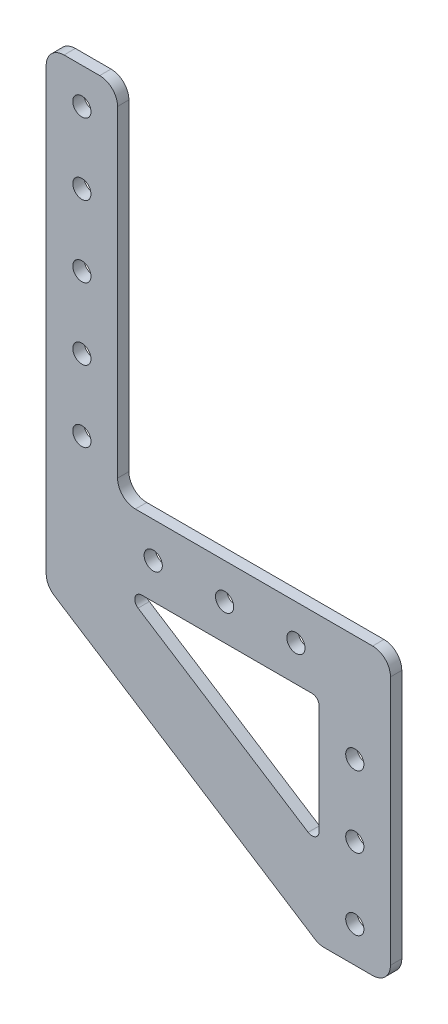
from build123d import *
from OCP.BRepFilletAPI import BRepFilletAPI_MakeFillet

# Parameters (mm, degrees)
SKETCH1_R           = 2.55
BOSS_EXTRUDE1_DEPTH = 1.5875
FILLET1_R1          = 5
FILLET1_R2          = 2


with BuildPart() as part:
    # Sketch1 → Boss-Extrude1 (new, symmetric)
    with BuildSketch(Plane.XY):
        Polygon((-76.5, 120.217645026), (-56.5, 120.217645026), (-56.5, 20), (20, 20), (20, -60), (0, -60), (-76.5, -10.932354974), align=None)
        with Locations((-66.5, 110.217645026)):
            Circle(SKETCH1_R, mode=Mode.SUBTRACT)
        with Locations((-66.5, 90.217645026)):
            Circle(SKETCH1_R, mode=Mode.SUBTRACT)
        with Locations((10, -50)):
            Circle(SKETCH1_R, mode=Mode.SUBTRACT)
        with Locations((10, -30)):
            Circle(SKETCH1_R, mode=Mode.SUBTRACT)
        with Locations((10, -10)):
            Circle(SKETCH1_R, mode=Mode.SUBTRACT)
        with Locations((-46.5, 10)):
            Circle(SKETCH1_R, mode=Mode.SUBTRACT)
        with Locations((-26.5, 10)):
            Circle(SKETCH1_R, mode=Mode.SUBTRACT)
        with Locations((-6.5, 10)):
            Circle(SKETCH1_R, mode=Mode.SUBTRACT)
        with Locations((-66.5, 70.217645026)):
            Circle(SKETCH1_R, mode=Mode.SUBTRACT)
        with Locations((-66.5, 50.217645026)):
            Circle(SKETCH1_R, mode=Mode.SUBTRACT)
        with Locations((-66.5, 30.217645026)):
            Circle(SKETCH1_R, mode=Mode.SUBTRACT)
        Polygon((0, -36.239502536), (0, 0), (-56.5, 0), align=None, mode=Mode.SUBTRACT)
    extrude(amount=BOSS_EXTRUDE1_DEPTH, both=True)

    # Fillet1: one fillet with a radius per group of edges: ONE call of the kernel's fillet builder (fillet() takes one radius for all edges)
    fillet1_edges_1 = [part.edges().sort_by_distance(p)[0] for p in [
        (-56.5, 120.217645026, 0),
        (-76.5, 120.217645026, 0),
        (-56.5, 20, 0),
        (20, 20, 0),
        (20, -60, 0),
        (0, -60, 0),
        (-76.5, -10.932354974, 0),
    ]]
    fillet1_edges_2 = [part.edges().sort_by_distance(p)[0] for p in [
        (0, 0, 0),
        (-56.5, 0, 0),
        (0, -36.239502536, 0),
    ]]
    fillet1 = BRepFilletAPI_MakeFillet(part.part.solid().wrapped)
    for e in fillet1_edges_1:
        fillet1.Add(FILLET1_R1, e.wrapped)
    for e in fillet1_edges_2:
        fillet1.Add(FILLET1_R2, e.wrapped)
    add(Compound.cast(fillet1.Shape()), mode=Mode.REPLACE)


solid = part.part
